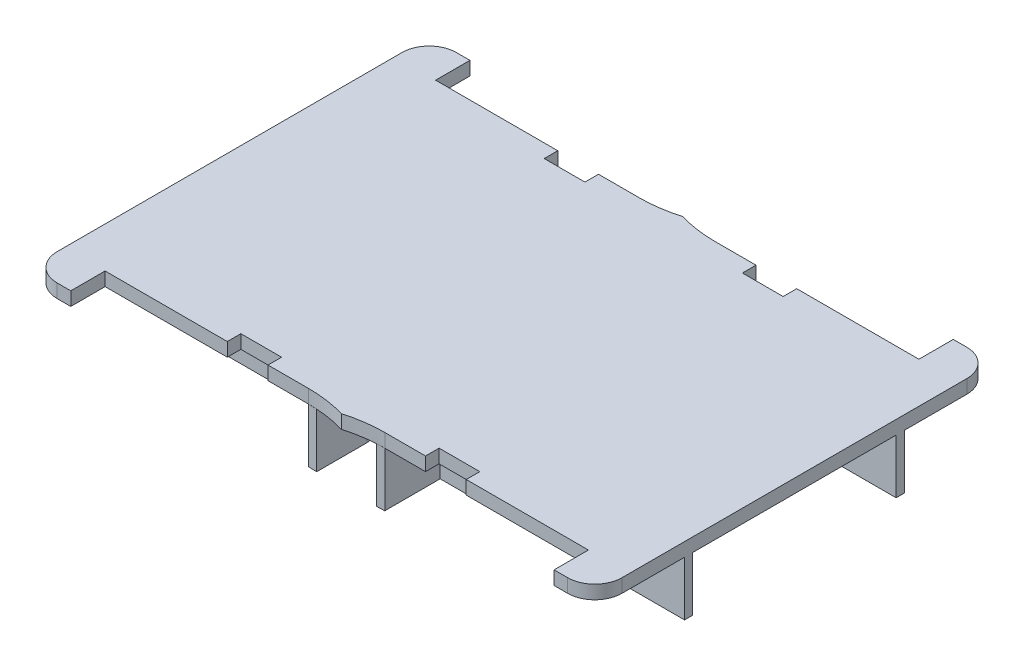
from build123d import *

# Parameters (mm, degrees)
CROQUIS1_W               = 208
CROQUIS1_H               = 147
SALIENTE_EXTRUIR1_DEPTH  = 5
CORTAR_EXTRUIR1_DEPTH    = 128.449009412
SIMETR_A2_COPY_1_DEPTH   = 128.449009412
REDONDEO1_R              = 10
SALIENTE_EXTRUIR3_DEPTH  = 20
REDONDEO2_R              = 5
REDONDEO2_OF_SIMETR_A3_R = 5
SIMETR_A4_START          = -20
SIMETR_A4_DEPTH          = 20
ESCALA1_SCALE            = 2


# Read off the part's stored shape, not the designer's step: Simetría4
with BuildPart() as part:
    # Croquis1 → Saliente-Extruir1 (new body)
    with BuildSketch(Plane(origin=(0, 0, 0), x_dir=(1, 0, 0), z_dir=(0, 1, 0))):
        Rectangle(CROQUIS1_W, CROQUIS1_H)
    extrude(amount=SALIENTE_EXTRUIR1_DEPTH)

    # Croquis3 → Cortar-Extruir1 (cut, through all)
    with BuildSketch(Plane(origin=(0, 5, 0), x_dir=(1, 0, 0), z_dir=(0, 1, 0))):
        with BuildLine():
            Line((-89, 80.855395091), (-89, 60.855395091))
            Line((-89, 60.855395091), (-44, 60.855395091))
            Line((-44, 60.855395091), (-44, 55.855395091))
            Line((-44, 55.855395091), (-29, 55.855395091))
            Line((-29, 55.855395091), (-29, 60.855395091))
            Line((-29, 60.855395091), (-14, 60.855395091))
            ThreePointArc((-14, 60.855395091), (-6.928932188, 61.357920408), (0, 62.855395091))
            Line((0, 62.855395091), (0, 82.855395091))
            Line((0, 82.855395091), (-89, 82.855395091))
            Line((-89, 82.855395091), (-89, 80.855395091))
        make_face()
    cortar_extruir1 = extrude(amount=-CORTAR_EXTRUIR1_DEPTH, mode=Mode.SUBTRACT)

    # Simetría1: Cortar-Extruir1 across plane
    add(cortar_extruir1.mirror(Plane.XY), mode=Mode.SUBTRACT)

    # Simetría2: Cortar-Extruir1 across plane
    add(cortar_extruir1.mirror(Plane(origin=(0, 0, 0), x_dir=(0, 0, 1), z_dir=(1, 0, 0))), mode=Mode.SUBTRACT)

    # Simetría2 copy 1 sketch → Simetría2 copy 1 (cut, through all)
    with BuildSketch(Plane(origin=(0, 5, 0), x_dir=(-1, 0, 0), z_dir=(0, 1, 0))):
        with BuildLine():
            Line((-89, 80.855395091), (-89, 60.855395091))
            Line((-89, 60.855395091), (-44, 60.855395091))
            Line((-44, 60.855395091), (-44, 55.855395091))
            Line((-44, 55.855395091), (-29, 55.855395091))
            Line((-29, 55.855395091), (-29, 60.855395091))
            Line((-29, 60.855395091), (-14, 60.855395091))
            ThreePointArc((-14, 60.855395091), (-6.928932188, 61.357920408), (0, 62.855395091))
            Line((0, 62.855395091), (0, 82.855395091))
            Line((0, 82.855395091), (-89, 82.855395091))
            Line((-89, 82.855395091), (-89, 80.855395091))
        make_face()
    extrude(amount=-SIMETR_A2_COPY_1_DEPTH, mode=Mode.SUBTRACT)

    # Redondeo1
    redondeo1_edges = [part.edges().sort_by_distance(p)[0] for p in [
        (-104, 2.5, -73.5),
        (104, 2.5, -73.5),
        (104, 2.5, 73.5),
        (-104, 2.5, 73.5),
    ]]
    fillet(redondeo1_edges, radius=REDONDEO1_R)

    # Croquis5 → Saliente-Extruir3 (add)
    with BuildSketch(Plane.XZ):
        Polygon((-104, 37.458190843), (-11, 37.458190843), (-11, 60.945476237), (-14, 60.855395091), (-14, 40.458190843), (-104, 40.458190843), align=None)
    saliente_extruir3 = extrude(amount=SALIENTE_EXTRUIR3_DEPTH)

    # Redondeo2
    redondeo2_edges = [part.edges().sort_by_distance(p)[0] for p in [
        (-11, -10, 37.458190843),
    ]]
    fillet(redondeo2_edges, radius=REDONDEO2_R)

    # Simetría3: Saliente-Extruir3 across plane
    add(saliente_extruir3.mirror(Plane.XY))

    # Redondeo2 of Simetría3
    redondeo2_of_simetr_a3_edges = [part.edges().sort_by_distance(p)[0] for p in [
        (-11, -10, -37.458190843),
    ]]
    fillet(redondeo2_of_simetr_a3_edges, radius=REDONDEO2_OF_SIMETR_A3_R)

    # Simetría4 outline → Simetría4 (add)
    with BuildSketch(Plane(origin=(0, 0, 0), x_dir=(1, 0, 0), z_dir=(0, 1, 0)).offset(SIMETR_A4_START)):
        with BuildLine():
            Line((104, -40.458190843), (104, -37.458190843))
            Line((104, -37.458190843), (16, -37.458190843))
            ThreePointArc((16, -37.458190843), (12.464466094, -38.922656937), (11, -42.458190843))
            Line((11, -42.458190843), (11, -60.945476237))
            Line((11, -60.945476237), (14, -60.855395091))
            Line((14, -60.855395091), (14, -40.458190843))
            Line((14, -40.458190843), (104, -40.458190843))
        make_face()
        with BuildLine():
            Line((104, 37.458190843), (104, 40.458190843))
            Line((104, 40.458190843), (14, 40.458190843))
            Line((14, 40.458190843), (14, 60.855395091))
            Line((14, 60.855395091), (11, 60.945476237))
            Line((11, 60.945476237), (11, 42.458190843))
            ThreePointArc((11, 42.458190843), (12.464466094, 38.922656937), (16, 37.458190843))
            Line((16, 37.458190843), (104, 37.458190843))
        make_face()
    extrude(amount=SIMETR_A4_DEPTH)


with BuildPart() as part_1:
    # Escala1: scaled about (0, 0.344872769, 0)
    add(part.part.scale(ESCALA1_SCALE).moved(Location((0, -0.344872769, 0))))


solid = part_1.part
